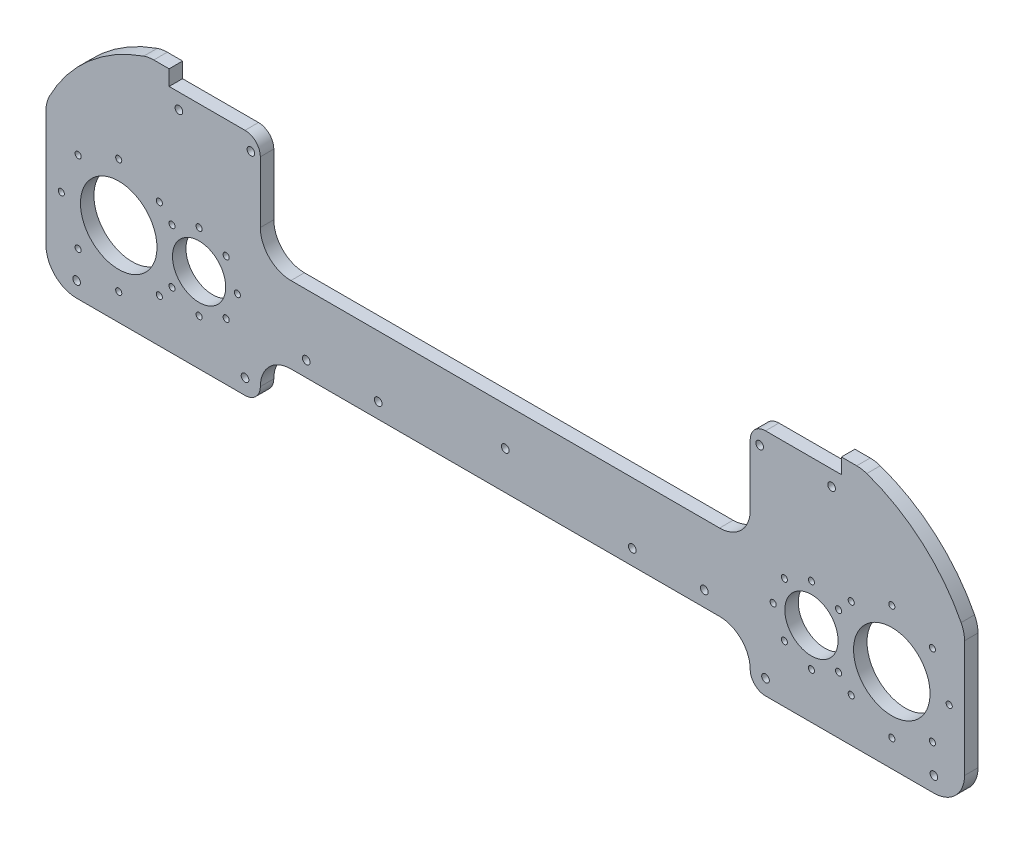
from build123d import *

# Parameters (mm, degrees)
SKETCH1_R           = 3.175
BOSS_EXTRUDE1_DEPTH = 2.794
SKETCH2_R           = 11.049
SKETCH2_R_2         = 15.875
SKETCH2_R_3         = 1.27
CUT_EXTRUDE1_DEPTH  = 202.908472752
ITC_CUTOUT_DEPTH    = 202.908472752
SKETCH6_W           = 67.523241089
SKETCH6_H           = 6.35
CUT_EXTRUDE3_DEPTH  = 202.908472752
FILLET1_R           = 6.35
CUT_EXTRUDE4_DEPTH  = 202.908472752
FILLET2_R           = 6.35
SKETCH8_R           = 1.5875
CUT_EXTRUDE5_DEPTH  = 202.908472752
SKETCH10_R          = 1.5875
CUT_EXTRUDE6_DEPTH  = 202.908472752
SKETCH11_R          = 1.5875
CUT_EXTRUDE7_DEPTH  = 202.908472752


with BuildPart() as part:
    # Sketch1 → Boss-Extrude1 (new, symmetric)
    with BuildSketch(Plane.XY):
        with BuildLine():
            Line((-145.783553311, 66.675), (145.783553311, 66.675))
            ThreePointArc((145.783553311, 66.675), (147.900219978, 66.497368874), (149.957676269, 65.969444444))
            ThreePointArc((149.957676269, 65.969444444), (172.789871953, 52.74760778), (189.088888889, 31.999880883))
            ThreePointArc((189.088888889, 31.999880883), (190.142181511, 29.17513943), (190.5, 26.181720723))
            Line((190.5, 26.181720723), (190.5, -22.225))
            ThreePointArc((190.5, -22.225), (186.780256121, -31.205256121), (177.8, -34.925))
            Line((177.8, -34.925), (-177.8, -34.925))
            ThreePointArc((-177.8, -34.925), (-186.780256121, -31.205256121), (-190.5, -22.225))
            Line((-190.5, -22.225), (-190.5, 26.181720723))
            ThreePointArc((-190.5, 26.181720723), (-190.142181511, 29.17513943), (-189.088888889, 31.999880883))
            ThreePointArc((-189.088888889, 31.999880883), (-172.789871953, 52.74760778), (-149.957676269, 65.969444444))
            ThreePointArc((-149.957676269, 65.969444444), (-147.900219978, 66.497368874), (-145.783553311, 66.675))
        make_face()
        with Locations((-127, 0)):
            Circle(SKETCH1_R, mode=Mode.SUBTRACT)
        with Locations((127, 0)):
            Circle(SKETCH1_R, mode=Mode.SUBTRACT)
    extrude(amount=BOSS_EXTRUDE1_DEPTH, both=True)

    # Sketch2 → Cut-Extrude1 (cut, through all)
    with BuildSketch(Plane.XY.offset(2.794)):
        with Locations((-127, 0)):
            Circle(SKETCH2_R)
        with Locations((-160.3375, 0)):
            Circle(SKETCH2_R_2)
        with Locations((-143.499519773, 16.837980227)):
            Circle(SKETCH2_R_3)
        with Locations((-160.3375, 23.8125)):
            Circle(SKETCH2_R_3)
        with Locations((-143.499519773, -16.837980227)):
            Circle(SKETCH2_R_3)
        with Locations((-160.3375, -23.8125)):
            Circle(SKETCH2_R_3)
        with Locations((-177.175480227, -16.837980227)):
            Circle(SKETCH2_R_3)
        with Locations((-184.15, 0)):
            Circle(SKETCH2_R_3)
        with Locations((-177.175480227, 16.837980227)):
            Circle(SKETCH2_R_3)
        with Locations((-127, 15.875)):
            Circle(SKETCH2_R_3)
        with Locations((-115.774679849, 11.225320151)):
            Circle(SKETCH2_R_3)
        with Locations((-111.125, 0)):
            Circle(SKETCH2_R_3)
        with Locations((-115.774679849, -11.225320151)):
            Circle(SKETCH2_R_3)
        with Locations((-127, -15.875)):
            Circle(SKETCH2_R_3)
        with Locations((-138.225320151, -11.225320151)):
            Circle(SKETCH2_R_3)
        with Locations(Location((138.225320151, 11.225320151, 0), (0, 0, 180))):
            Circle(SKETCH2_R_3)
        with Locations((-138.225320151, 11.225320151)):
            Circle(SKETCH2_R_3)
        with Locations(Location((138.225320151, -11.225320151, 0), (0, 0, 180))):
            Circle(SKETCH2_R_3)
        with Locations(Location((127, -15.875, 0), (0, 0, 180))):
            Circle(SKETCH2_R_3)
        with Locations(Location((115.774679849, -11.225320151, 0), (0, 0, 180))):
            Circle(SKETCH2_R_3)
        with Locations(Location((111.125, 0, 0), (0, 0, 180))):
            Circle(SKETCH2_R_3)
        with Locations(Location((115.774679849, 11.225320151, 0), (0, 0, 180))):
            Circle(SKETCH2_R_3)
        with Locations(Location((127, 15.875, 0), (0, 0, 180))):
            Circle(SKETCH2_R_3)
        with Locations(Location((177.175480227, 16.837980227, 0), (0, 0, 180))):
            Circle(SKETCH2_R_3)
        with Locations(Location((184.15, 0, 0), (0, 0, 180))):
            Circle(SKETCH2_R_3)
        with Locations(Location((177.175480227, -16.837980227, 0), (0, 0, 180))):
            Circle(SKETCH2_R_3)
        with Locations(Location((160.3375, -23.8125, 0), (0, 0, 180))):
            Circle(SKETCH2_R_3)
        with Locations(Location((143.499519773, -16.837980227, 0), (0, 0, 180))):
            Circle(SKETCH2_R_3)
        with Locations(Location((160.3375, 23.8125, 0), (0, 0, 180))):
            Circle(SKETCH2_R_3)
        with Locations(Location((143.499519773, 16.837980227, 0), (0, 0, 180))):
            Circle(SKETCH2_R_3)
        with Locations(Location((160.3375, 0, 0), (0, 0, 180))):
            Circle(SKETCH2_R_2)
        with Locations(Location((127, 0, 0), (0, 0, 180))):
            Circle(SKETCH2_R)
    extrude(amount=-CUT_EXTRUDE1_DEPTH, mode=Mode.SUBTRACT)

    # Sketch5 → ITC_Cutout (cut, through all)
    with BuildSketch(Plane.XY.offset(2.794)):
        with BuildLine():
            Line((-88.9, 15.875), (88.9, 15.875))
            ThreePointArc((88.9, 15.875), (97.880256121, 19.594743879), (101.6, 28.575))
            Line((101.6, 28.575), (101.6, 66.675))
            Line((101.6, 66.675), (-101.6, 66.675))
            Line((-101.6, 66.675), (-101.6, 28.575))
            ThreePointArc((-101.6, 28.575), (-97.880256121, 19.594743879), (-88.9, 15.875))
        make_face()
    extrude(amount=-ITC_CUTOUT_DEPTH, mode=Mode.SUBTRACT)

    # Sketch6 → Cut-Extrude3 (cut, through all)
    with BuildSketch(Plane.XY.offset(2.794)):
        with Locations((-105.671932766, 63.5)):
            Rectangle(SKETCH6_W, SKETCH6_H)
        with Locations((105.671932766, 63.5)):
            Rectangle(SKETCH6_W, SKETCH6_H)
    extrude(amount=-CUT_EXTRUDE3_DEPTH, mode=Mode.SUBTRACT)

    # Fillet1
    fillet1_edges = [part.edges().sort_by_distance(p)[0] for p in [
        (-101.6, 60.325, 0),
        (101.6, 60.325, 0),
    ]]
    fillet(fillet1_edges, radius=FILLET1_R)

    # Sketch7 → Cut-Extrude4 (cut, through all)
    with BuildSketch(Plane.XY.offset(2.794)):
        with BuildLine():
            Line((-88.9, -15.875), (88.9, -15.875))
            ThreePointArc((88.9, -15.875), (97.880256121, -19.594743879), (101.6, -28.575))
            Line((101.6, -28.575), (101.6, -34.925))
            Line((101.6, -34.925), (-101.6, -34.925))
            Line((-101.6, -34.925), (-101.6, -28.575))
            ThreePointArc((-101.6, -28.575), (-97.880256121, -19.594743879), (-88.9, -15.875))
        make_face()
    extrude(amount=-CUT_EXTRUDE4_DEPTH, mode=Mode.SUBTRACT)

    # Fillet2
    fillet2_edges = [part.edges().sort_by_distance(p)[0] for p in [
        (101.6, -34.925, 0),
        (-101.6, -34.925, 0),
    ]]
    fillet(fillet2_edges, radius=FILLET2_R - 0.0001)  # a hair under: the kernel refuses the full size

    # Sketch8 → Cut-Extrude5 (cut, through all)
    with BuildSketch(Plane.XY.offset(2.794)):
        with Locations((-135.369553311, 53.975)):
            Circle(SKETCH8_R)
        with Locations((-105.524553311, 53.975)):
            Circle(SKETCH8_R)
        with Locations(Location((105.524553311, 53.975, 0), (0, 0, 180))):
            Circle(SKETCH8_R)
        with Locations(Location((135.369553311, 53.975, 0), (0, 0, 180))):
            Circle(SKETCH8_R)
    extrude(amount=-CUT_EXTRUDE5_DEPTH, mode=Mode.SUBTRACT)

    # Sketch10 → Cut-Extrude6 (cut, through all)
    with BuildSketch(Plane.XY.offset(2.794)):
        with Locations((-177.8, -28.575)):
            Circle(SKETCH10_R)
        with Locations((-107.95, -28.575)):
            Circle(SKETCH10_R)
        with Locations(Location((107.95, -28.575, 0), (0, 0, 180))):
            Circle(SKETCH10_R)
        with Locations(Location((177.8, -28.575, 0), (0, 0, 180))):
            Circle(SKETCH10_R)
        Circle(SKETCH10_R)
    extrude(amount=-CUT_EXTRUDE6_DEPTH, mode=Mode.SUBTRACT)

    # Sketch11 → Cut-Extrude7 (cut, through all)
    with BuildSketch(Plane.XY.offset(2.794)):
        with Locations((-82.55, -9.525)):
            Circle(SKETCH11_R)
        with Locations((-52.705, -9.525)):
            Circle(SKETCH11_R)
        with Locations(Location((52.705, -9.525, 0), (0, 0, 180))):
            Circle(SKETCH11_R)
        with Locations(Location((82.55, -9.525, 0), (0, 0, 180))):
            Circle(SKETCH11_R)
    extrude(amount=-CUT_EXTRUDE7_DEPTH, mode=Mode.SUBTRACT)


solid = part.part
